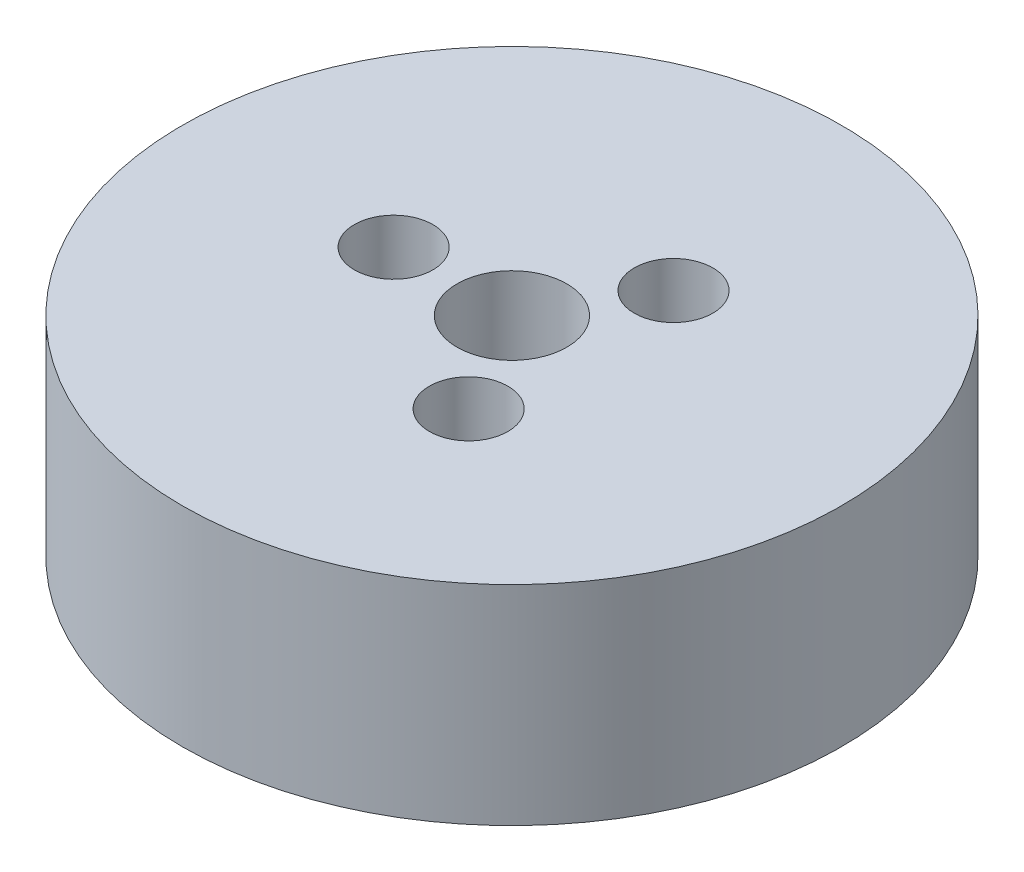
from build123d import *

# Parameters (mm, degrees)
SKETCH1_R           = 30
BOSS_EXTRUDE1_DEPTH = 19
SKETCH2_R           = 5
CUT_EXTRUDE1_DEPTH  = 47.486557197
SKETCH3_R           = 3.576417547
CUT_EXTRUDE2_DEPTH  = 16.607177659
CIRPATTERN1_COUNT   = 3


with BuildPart() as part:
    # Sketch1 → Boss-Extrude1 (new body)
    with BuildSketch(Plane(origin=(0, 0, 0), x_dir=(1, 0, 0), z_dir=(0, 1, 0))):
        Circle(SKETCH1_R)
    extrude(amount=BOSS_EXTRUDE1_DEPTH)

    # Sketch2 → Cut-Extrude1 (cut, through all)
    with BuildSketch(Plane(origin=(0, 0, 0), x_dir=(1, 0, 0), z_dir=(0, 1, 0))):
        Circle(SKETCH2_R)
    extrude(amount=CUT_EXTRUDE1_DEPTH, mode=Mode.SUBTRACT)

    # Sketch3 → Cut-Extrude2 (cut)
    with BuildSketch(Plane(origin=(0, 19, 0), x_dir=(1, 0, 0), z_dir=(0, 1, 0))):
        with Locations((-10.769340173, 0)):
            Circle(SKETCH3_R)
    cut_extrude2 = extrude(amount=-CUT_EXTRUDE2_DEPTH, mode=Mode.SUBTRACT)

    # CirPattern1: Cut-Extrude2 ×3 about axis
    cirpattern1_axis = Axis((0, 0, 0), (0, 1, 0))
    for i in range(1, CIRPATTERN1_COUNT):
        add(cut_extrude2.rotate(cirpattern1_axis, i * 360 / CIRPATTERN1_COUNT), mode=Mode.SUBTRACT)


solid = part.part
